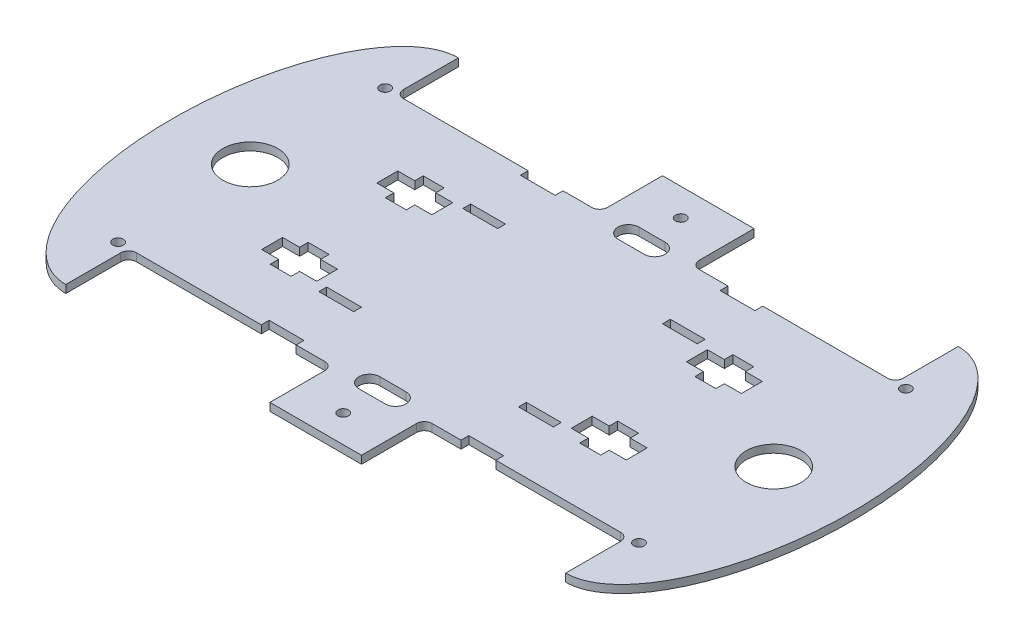
from build123d import *

# Parameters (mm, degrees)
BOSS_EXTRUDE1_OUTLINE_R   = 2
BOSS_EXTRUDE1_OUTLINE_R_2 = 10.5
BOSS_EXTRUDE1_OUTLINE_W   = 13.3
BOSS_EXTRUDE1_OUTLINE_H   = 3
BOSS_EXTRUDE1_DEPTH       = 3
SCALE1_SCALE              = 0.95


# Read off the part's stored shape, not the designer's step: Boss-Extrude1
with BuildPart() as part:
    # Boss-Extrude1 outline → Boss-Extrude1 (new body)
    with BuildSketch(Plane(origin=(0, 0, 0), x_dir=(1, 0, 0), z_dir=(0, 1, 0))):
        with BuildLine():
            Line((-17.5, -75), (17.5, -75))
            Line((17.5, -75), (17.5, -54))
            ThreePointArc((17.5, -54), (18.378679656, -51.878679656), (20.5, -51))
            Line((20.5, -51), (31.5, -51))
            Line((31.5, -51), (31.5, -48))
            Line((31.5, -48), (44.8, -48))
            Line((44.8, -48), (44.8, -51))
            Line((44.8, -51), (92.5, -51))
            ThreePointArc((92.5, -51), (94.621320344, -51.878679656), (95.5, -54))
            Line((95.5, -54), (95.5, -75))
            add(Edge.make_bspline(
                [(95.5, 75), (130, 75), (130, 0), (130, -75), (95.5, -75)],
                knots=[3.141592654, 3.141592654, 3.141592654, 4.71238898, 4.71238898, 6.283185307, 6.283185307, 6.283185307], degree=2, weights=[1, 0.707106781, 1, 0.707106781, 1]))
            Line((95.5, 75), (95.5, 54))
            ThreePointArc((95.5, 54), (94.621320344, 51.878679656), (92.5, 51))
            Line((92.5, 51), (44.8, 51))
            Line((44.8, 51), (44.8, 48))
            Line((44.8, 48), (31.5, 48))
            Line((31.5, 48), (31.5, 51))
            Line((31.5, 51), (20.5, 51))
            ThreePointArc((20.5, 51), (18.378679656, 51.878679656), (17.5, 54))
            Line((17.5, 54), (17.5, 75))
            Line((17.5, 75), (-17.5, 75))
            Line((-17.5, 75), (-17.5, 54))
            ThreePointArc((-17.5, 54), (-18.378679656, 51.878679656), (-20.5, 51))
            Line((-20.5, 51), (-31.5, 51))
            Line((-31.5, 51), (-31.5, 48))
            Line((-31.5, 48), (-44.8, 48))
            Line((-44.8, 48), (-44.8, 51))
            Line((-44.8, 51), (-92.5, 51))
            ThreePointArc((-92.5, 51), (-94.621320344, 51.878679656), (-95.5, 54))
            Line((-95.5, 54), (-95.5, 75))
            add(Edge.make_bspline(
                [(-95.5, 75), (-130, 75), (-130, 0), (-130, -75), (-95.5, -75)],
                knots=[3.141592654, 3.141592654, 3.141592654, 4.71238898, 4.71238898, 6.283185307, 6.283185307, 6.283185307], degree=2, weights=[1, 0.707106781, 1, 0.707106781, 1]))
            Line((-95.5, -75), (-95.5, -54))
            ThreePointArc((-95.5, -54), (-94.621320344, -51.878679656), (-92.5, -51))
            Line((-92.5, -51), (-44.8, -51))
            Line((-44.8, -51), (-44.8, -48))
            Line((-44.8, -48), (-31.5, -48))
            Line((-31.5, -48), (-31.5, -51))
            Line((-31.5, -51), (-20.5, -51))
            ThreePointArc((-20.5, -51), (-18.378679656, -51.878679656), (-17.5, -54))
            Line((-17.5, -54), (-17.5, -75))
        make_face()
        with Locations((-99.5, -51)):
            Circle(BOSS_EXTRUDE1_OUTLINE_R, mode=Mode.SUBTRACT)
        with Locations((0, -64.5)):
            Circle(BOSS_EXTRUDE1_OUTLINE_R, mode=Mode.SUBTRACT)
        with BuildLine():
            Line((-5, -45.5), (5, -45.5))
            ThreePointArc((5, -45.5), (9, -49.5), (5, -53.5))
            Line((5, -53.5), (-5, -53.5))
            ThreePointArc((-5, -53.5), (-9, -49.5), (-5, -45.5))
        make_face(mode=Mode.SUBTRACT)
        with Locations((-100, 0)):
            Circle(BOSS_EXTRUDE1_OUTLINE_R_2, mode=Mode.SUBTRACT)
        Polygon((-63.15, -29.25), (-63.15, -26), (-69.65, -26), (-69.65, -18), (-63.15, -18), (-63.15, -14.75), (-55.15, -14.75), (-55.15, -18), (-48.65, -18), (-48.65, -26), (-55.15, -26), (-55.15, -29.25), align=None, mode=Mode.SUBTRACT)
        with Locations((-38.15, -27.5)):
            Rectangle(BOSS_EXTRUDE1_OUTLINE_W, BOSS_EXTRUDE1_OUTLINE_H, mode=Mode.SUBTRACT)
        with Locations((99.5, -51)):
            Circle(BOSS_EXTRUDE1_OUTLINE_R, mode=Mode.SUBTRACT)
        with Locations((38.15, -27.5)):
            Rectangle(BOSS_EXTRUDE1_OUTLINE_W, BOSS_EXTRUDE1_OUTLINE_H, mode=Mode.SUBTRACT)
        Polygon((55.15, -18), (55.15, -14.75), (63.15, -14.75), (63.15, -18), (69.65, -18), (69.65, -26), (63.15, -26), (63.15, -29.25), (55.15, -29.25), (55.15, -26), (48.65, -26), (48.65, -18), align=None, mode=Mode.SUBTRACT)
        with Locations((100, 0)):
            Circle(BOSS_EXTRUDE1_OUTLINE_R_2, mode=Mode.SUBTRACT)
        Polygon((-63.15, 29.25), (-55.15, 29.25), (-55.15, 26), (-48.65, 26), (-48.65, 18), (-55.15, 18), (-55.15, 14.75), (-63.15, 14.75), (-63.15, 18), (-69.65, 18), (-69.65, 26), (-63.15, 26), align=None, mode=Mode.SUBTRACT)
        with Locations((-38.15, 27.5)):
            Rectangle(BOSS_EXTRUDE1_OUTLINE_W, BOSS_EXTRUDE1_OUTLINE_H, mode=Mode.SUBTRACT)
        with Locations((-99.5, 51)):
            Circle(BOSS_EXTRUDE1_OUTLINE_R, mode=Mode.SUBTRACT)
        with BuildLine():
            Line((-5, 53.5), (5, 53.5))
            ThreePointArc((5, 53.5), (9, 49.5), (5, 45.5))
            Line((5, 45.5), (-5, 45.5))
            ThreePointArc((-5, 45.5), (-9, 49.5), (-5, 53.5))
        make_face(mode=Mode.SUBTRACT)
        with Locations((0, 64.5)):
            Circle(BOSS_EXTRUDE1_OUTLINE_R, mode=Mode.SUBTRACT)
        with Locations((38.15, 27.5)):
            Rectangle(BOSS_EXTRUDE1_OUTLINE_W, BOSS_EXTRUDE1_OUTLINE_H, mode=Mode.SUBTRACT)
        Polygon((63.15, 29.25), (63.15, 26), (69.65, 26), (69.65, 18), (63.15, 18), (63.15, 14.75), (55.15, 14.75), (55.15, 18), (48.65, 18), (48.65, 26), (55.15, 26), (55.15, 29.25), align=None, mode=Mode.SUBTRACT)
        with Locations((99.5, 51)):
            Circle(BOSS_EXTRUDE1_OUTLINE_R, mode=Mode.SUBTRACT)
    extrude(amount=BOSS_EXTRUDE1_DEPTH)


with BuildPart() as part_1:
    # Scale1: scaled about (0, 0, 0)
    add(part.part.scale(SCALE1_SCALE))


solid = part_1.part
